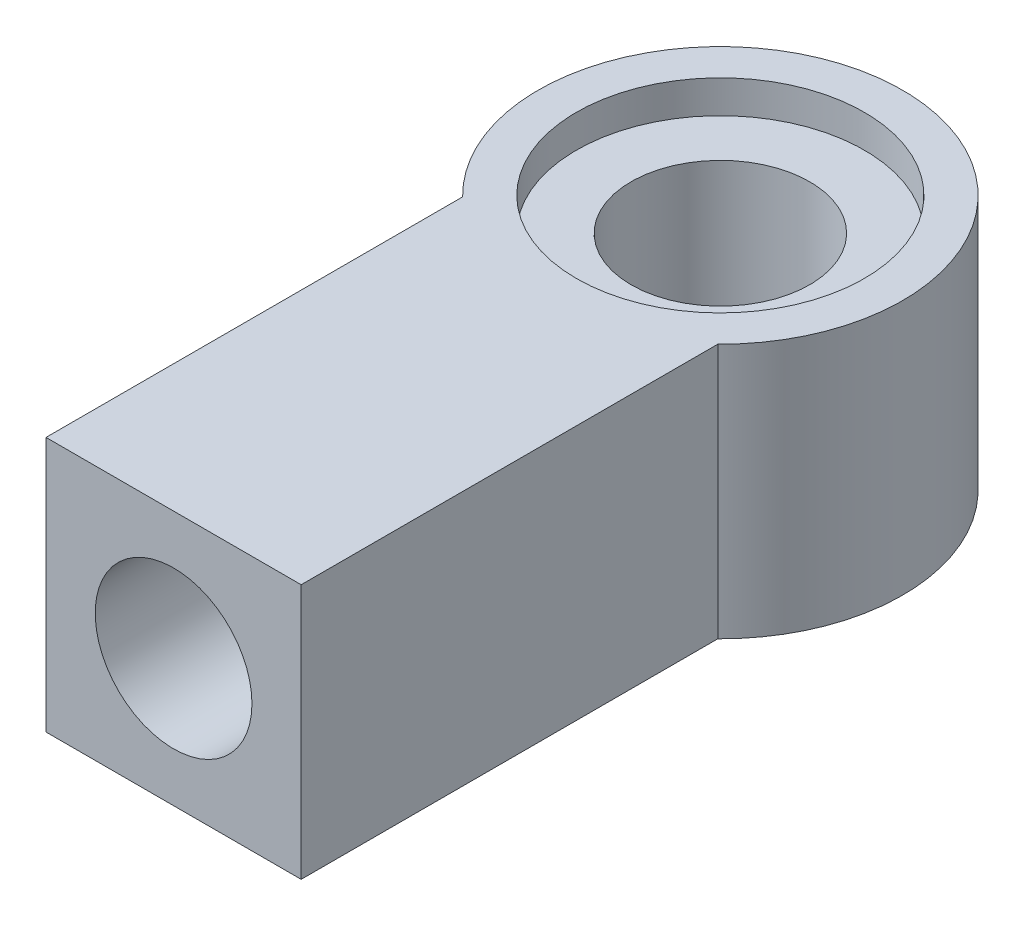
from build123d import *

# Parameters (mm, degrees)
SKETCH1_R           = 5
SKETCH1_R_2         = 2.45
BOSS_EXTRUDE1_DEPTH = 7
SKETCH2_W           = 7
SKETCH2_H           = 7
BOSS_EXTRUDE3_DEPTH = 1.5
SKETCH4_W           = 7
SKETCH4_H           = 7
SKETCH4_R           = 2.15
BOSS_EXTRUDE4_DEPTH = 10
SKETCH5_R           = 3.95
CUT_EXTRUDE1_DEPTH  = 0.9


with BuildPart() as part:
    # Sketch1 → Boss-Extrude1 (new body)
    with BuildSketch(Plane(origin=(0, 0, 0), x_dir=(1, 0, 0), z_dir=(0, 1, 0))):
        Circle(SKETCH1_R)
        Circle(SKETCH1_R_2, mode=Mode.SUBTRACT)
    extrude(amount=BOSS_EXTRUDE1_DEPTH)

    # Sketch2 → Boss-Extrude3 (add)
    with BuildSketch(Plane.XY.offset(5)):
        with Locations((0, 3.5)):
            Rectangle(SKETCH2_W, SKETCH2_H)
    extrude(amount=-BOSS_EXTRUDE3_DEPTH)

    # Sketch4 → Boss-Extrude4 (add)
    with BuildSketch(Plane.XY.offset(5)):
        with Locations((0, 3.5)):
            Rectangle(SKETCH4_W, SKETCH4_H)
        with Locations((0, 3.5)):
            Circle(SKETCH4_R, mode=Mode.SUBTRACT)
    extrude(amount=BOSS_EXTRUDE4_DEPTH)

    # Sketch5 → Cut-Extrude1 (cut)
    with BuildSketch(Plane(origin=(0, 7, 0), x_dir=(1, 0, 0), z_dir=(0, 1, 0))):
        Circle(SKETCH5_R)
    extrude(amount=-CUT_EXTRUDE1_DEPTH, mode=Mode.SUBTRACT)


solid = part.part
